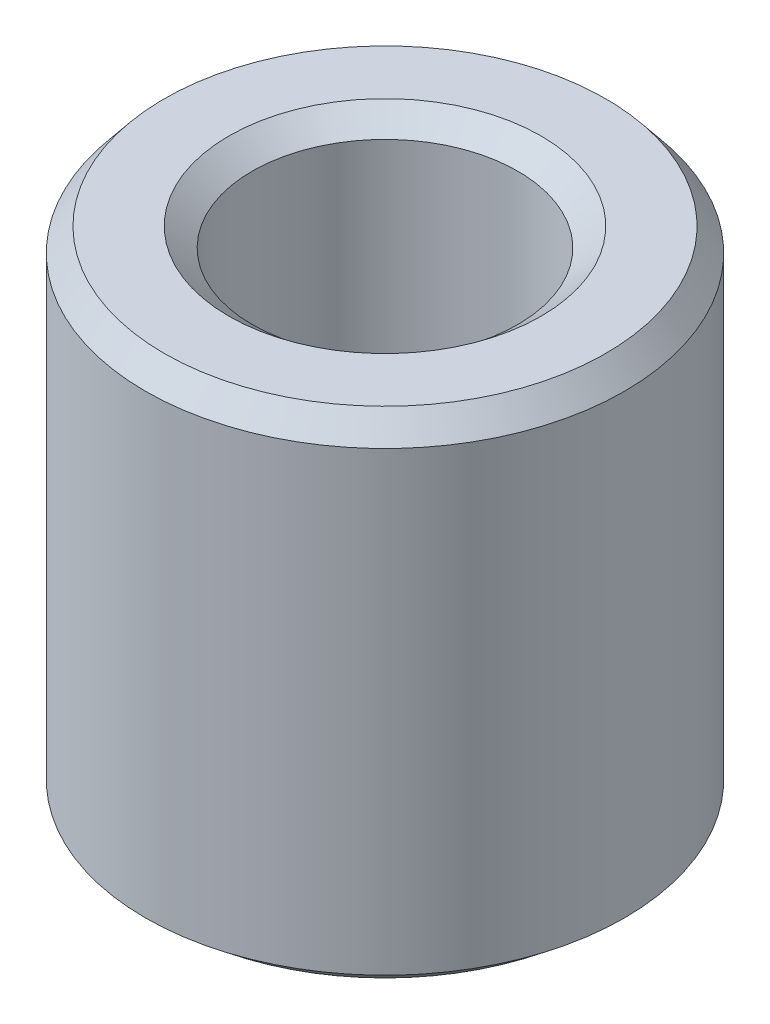
from build123d import *
from OCP.BRepFilletAPI import BRepFilletAPI_MakeChamfer

# Parameters (mm, degrees)
SKETCH1_R           = 30
BOSS_EXTRUDE1_DEPTH = 62.410966413
SKETCH2_R           = 16.640288541
CUT_EXTRUDE1_DEPTH  = 76.466076675
CHAMFER1_SIZE       = 2.916748383
CHAMFER1_SIZE2      = 2.359594206


with BuildPart() as part:
    # Sketch1 → Boss-Extrude1 (new body)
    with BuildSketch(Plane(origin=(0, 0, 0), x_dir=(1, 0, 0), z_dir=(0, 1, 0))):
        Circle(SKETCH1_R)
    extrude(amount=BOSS_EXTRUDE1_DEPTH)

    # Sketch2 → Cut-Extrude1 (cut, through all)
    with BuildSketch(Plane(origin=(0, 0, 0), x_dir=(1, 0, 0), z_dir=(0, 1, 0))):
        Circle(SKETCH2_R)
    extrude(amount=CUT_EXTRUDE1_DEPTH, mode=Mode.SUBTRACT)

    # Chamfer1: one chamfer whose edges measure the first distance from different faces: ONE call of the kernel's chamfer builder (chamfer() names one face for all edges)
    chamfer1_edges_1 = [part.edges().sort_by_distance(p)[0] for p in [
        (-16.640288541, 62.410966413, 0),
    ]]
    chamfer1_side_1 = [part.faces().sort_by_distance(p)[0] for p in [
        (-29.151471863, 62.410966413, 0),
    ]]
    chamfer1_edges_2 = [part.edges().sort_by_distance(p)[0] for p in [
        (-16.640288541, 0, 0),
    ]]
    chamfer1_side_2 = [part.faces().sort_by_distance(p)[0] for p in [
        (-16.640288541, 31.205483207, 0),
    ]]
    chamfer1_edges_3 = [part.edges().sort_by_distance(p)[0] for p in [
        (-30, 0, 0),
    ]]
    chamfer1_side_3 = [part.faces().sort_by_distance(p)[0] for p in [
        (-29.151471863, 0, 0),
    ]]
    chamfer1_edges_4 = [part.edges().sort_by_distance(p)[0] for p in [
        (-30, 62.410966413, 0),
    ]]
    chamfer1_side_4 = [part.faces().sort_by_distance(p)[0] for p in [
        (-30, 31.205483207, 0),
    ]]
    chamfer1 = BRepFilletAPI_MakeChamfer(part.part.solid().wrapped)
    for e in chamfer1_edges_1:
        chamfer1.Add(CHAMFER1_SIZE, CHAMFER1_SIZE2, e.wrapped, chamfer1_side_1[0].wrapped)  # the first distance lies on this face
    for e in chamfer1_edges_2:
        chamfer1.Add(CHAMFER1_SIZE, CHAMFER1_SIZE2, e.wrapped, chamfer1_side_2[0].wrapped)  # the first distance lies on this face
    for e in chamfer1_edges_3:
        chamfer1.Add(CHAMFER1_SIZE, CHAMFER1_SIZE2, e.wrapped, chamfer1_side_3[0].wrapped)  # the first distance lies on this face
    for e in chamfer1_edges_4:
        chamfer1.Add(CHAMFER1_SIZE, CHAMFER1_SIZE2, e.wrapped, chamfer1_side_4[0].wrapped)  # the first distance lies on this face
    add(Compound.cast(chamfer1.Shape()), mode=Mode.REPLACE)


solid = part.part
